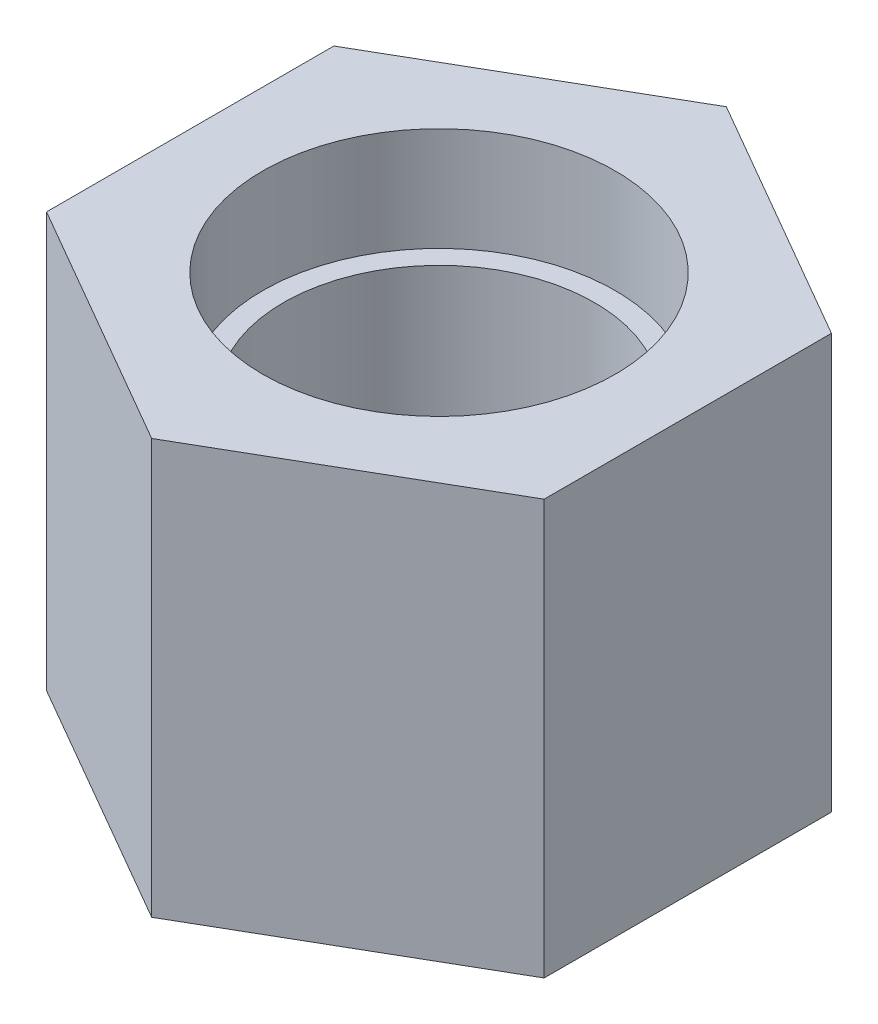
from build123d import *

# Parameters (mm, degrees)
SKETCH_1_R          = 7.5
EXTRUDE_1_DEPTH     = 20
SKETCH_3_R          = 8.5
CUT_EXTRUDE_2_DEPTH = 5


with BuildPart() as part:
    # Эскиз1 → Бобышка-Вытянуть1 (new body)
    with BuildSketch(Plane(origin=(0, 0, 0), x_dir=(1, 0, 0), z_dir=(0, 1, 0))):
        Polygon((0, 13.856406461), (-12, 6.92820323), (-12, -6.92820323), (0, -13.856406461), (12, -6.92820323), (12, 6.92820323), align=None)
        Circle(SKETCH_1_R, mode=Mode.SUBTRACT)
    extrude(amount=EXTRUDE_1_DEPTH)

    # Эскиз3 → Вырез-Вытянуть2 (cut)
    with BuildSketch(Plane(origin=(0, 20, 0), x_dir=(1, 0, 0), z_dir=(0, 1, 0))):
        Circle(SKETCH_3_R)
    extrude(amount=-CUT_EXTRUDE_2_DEPTH, mode=Mode.SUBTRACT)


solid = part.part
